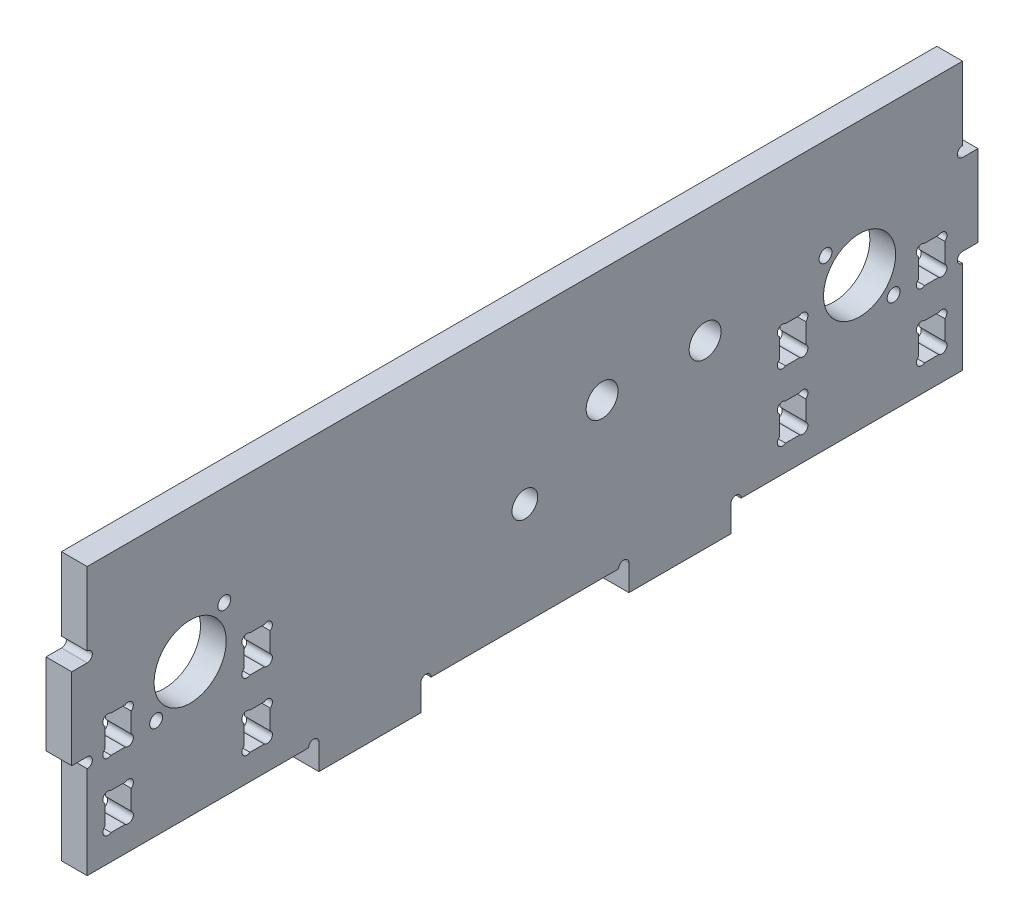
from build123d import *

# Parameters (mm, degrees)
SKETCH_1_W          = 170
SKETCH_1_H          = 52
EXTRUDE_1_DEPTH     = 5
SKETCH_2_R          = 7
CUT_EXTRUDE_1_DEPTH = 10
SKETCH_3_W          = 19.8
SKETCH_3_H          = 5
EXTRUDE_2_DEPTH     = 5
SKETCH_8_W          = 3
SKETCH_8_H          = 15.8
EXTRUDE_3_DEPTH     = 5
SKETCH_7_R          = 1
CUT_EXTRUDE_3_DEPTH = 10
SKETCH_10_W         = 5.1
SKETCH_10_H         = 7.1
CUT_EXTRUDE_4_DEPTH = 10
SKETCH_11_R         = 1
CUT_EXTRUDE_5_DEPTH = 10
SKETCH_13_R         = 3.1
SKETCH_13_R_2       = 2.5
CUT_EXTRUDE_7_DEPTH = 10
SKETCH_14_R         = 1.25
CUT_EXTRUDE_8_DEPTH = 10


with BuildPart() as part:
    # 스케치1 → 보스-돌출1 (new body)
    with BuildSketch(Plane(origin=(0, 0, 0), x_dir=(0, 0, -1), z_dir=(1, 0, 0))):
        with Locations((85, 26)):
            Rectangle(SKETCH_1_W, SKETCH_1_H)
    extrude(amount=EXTRUDE_1_DEPTH)

    # 스케치2 → 컷-돌출1 (cut)
    with BuildSketch(Plane(origin=(5, 0, 0), x_dir=(0, 0, -1), z_dir=(1, 0, 0))):
        with Locations((150, 26)):
            Circle(SKETCH_2_R)
        with Locations((20, 26)):
            Circle(SKETCH_2_R)
    extrude(amount=-CUT_EXTRUDE_1_DEPTH, mode=Mode.SUBTRACT)

    # 스케치3 → 보스-돌출2 (add)
    with BuildSketch(Plane(origin=(5, 0, 0), x_dir=(0, 0, -1), z_dir=(1, 0, 0))):
        with Locations((54.9, -2.5)):
            Rectangle(SKETCH_3_W, SKETCH_3_H)
        with Locations((115.1, -2.5)):
            Rectangle(SKETCH_3_W, SKETCH_3_H)
    extrude(amount=-EXTRUDE_2_DEPTH)

    # 스케치8 → 보스-돌출3 (add)
    with BuildSketch(Plane(origin=(5, 0, 0), x_dir=(0, 0, -1), z_dir=(1, 0, 0))):
        with Locations((171.5, 27.9)):
            Rectangle(SKETCH_8_W, SKETCH_8_H)
        with Locations((-1.5, 27.9)):
            Rectangle(SKETCH_8_W, SKETCH_8_H)
    extrude(amount=-EXTRUDE_3_DEPTH)

    # 스케치7 → 컷-돌출3 (cut)
    with BuildSketch(Plane(origin=(5, 0, 0), x_dir=(0, 0, -1), z_dir=(1, 0, 0))):
        with Locations((65.8, 0)):
            Circle(SKETCH_7_R)
        with Locations((44, 0)):
            Circle(SKETCH_7_R)
        with Locations((104.2, 0)):
            Circle(SKETCH_7_R)
        with Locations((126, 0)):
            Circle(SKETCH_7_R)
        with Locations((170, 36.8)):
            Circle(SKETCH_7_R)
        with Locations((170, 19)):
            Circle(SKETCH_7_R)
        with Locations((0, 36.8)):
            Circle(SKETCH_7_R)
        with Locations((0, 19)):
            Circle(SKETCH_7_R)
    extrude(amount=-CUT_EXTRUDE_3_DEPTH, mode=Mode.SUBTRACT)

    # 스케치10 → 컷-돌출4 (cut)
    with BuildSketch(Plane.ZY):
        with Locations((-163.999999999, 21.5)):
            Rectangle(SKETCH_10_W, SKETCH_10_H)
        with Locations((-136.999999999, 21.5)):
            Rectangle(SKETCH_10_W, SKETCH_10_H)
        with Locations((-163.999999999, 8.5)):
            Rectangle(SKETCH_10_W, SKETCH_10_H)
        with Locations((-136.999999999, 8.5)):
            Rectangle(SKETCH_10_W, SKETCH_10_H)
        with Locations((-33.000000001, 8.5)):
            Rectangle(SKETCH_10_W, SKETCH_10_H)
        with Locations((-6.000000001, 8.5)):
            Rectangle(SKETCH_10_W, SKETCH_10_H)
        with Locations((-33.000000001, 21.5)):
            Rectangle(SKETCH_10_W, SKETCH_10_H)
        with Locations((-6.000000001, 21.5)):
            Rectangle(SKETCH_10_W, SKETCH_10_H)
    extrude(amount=-CUT_EXTRUDE_4_DEPTH, mode=Mode.SUBTRACT)

    # 스케치11 → 컷-돌출5 (cut)
    with BuildSketch(Plane(origin=(5, 0, 0), x_dir=(0, 0, -1), z_dir=(1, 0, 0))):
        with Locations((165.966599684, 24.237815247)):
            Circle(SKETCH_11_R)
        with Locations((162.033400314, 24.237815247)):
            Circle(SKETCH_11_R)
        with Locations((165.966599684, 18.762184753)):
            Circle(SKETCH_11_R)
        with Locations((162.033400314, 18.762184753)):
            Circle(SKETCH_11_R)
        with Locations((138.966599684, 18.762184753)):
            Circle(SKETCH_11_R)
        with Locations((135.033400314, 18.762184753)):
            Circle(SKETCH_11_R)
        with Locations((138.966599684, 24.237815247)):
            Circle(SKETCH_11_R)
        with Locations((135.033400314, 24.237815247)):
            Circle(SKETCH_11_R)
        with Locations((135.033400314, 5.762184753)):
            Circle(SKETCH_11_R)
        with Locations((138.966599684, 5.762184753)):
            Circle(SKETCH_11_R)
        with Locations((135.033400314, 11.237815247)):
            Circle(SKETCH_11_R)
        with Locations((138.966599684, 11.237815247)):
            Circle(SKETCH_11_R)
        with Locations((162.033400314, 11.237815247)):
            Circle(SKETCH_11_R)
        with Locations((165.966599684, 11.237815247)):
            Circle(SKETCH_11_R)
        with Locations((162.033400314, 5.762184753)):
            Circle(SKETCH_11_R)
        with Locations((165.966599684, 5.762184753)):
            Circle(SKETCH_11_R)
        with Locations((4.033400316, 5.762184753)):
            Circle(SKETCH_11_R)
        with Locations((7.966599686, 5.762184753)):
            Circle(SKETCH_11_R)
        with Locations((4.033400316, 11.237815247)):
            Circle(SKETCH_11_R)
        with Locations((7.966599686, 11.237815247)):
            Circle(SKETCH_11_R)
        with Locations((31.033400316, 11.237815247)):
            Circle(SKETCH_11_R)
        with Locations((34.966599686, 11.237815247)):
            Circle(SKETCH_11_R)
        with Locations((31.033400316, 5.762184753)):
            Circle(SKETCH_11_R)
        with Locations((34.966599686, 5.762184753)):
            Circle(SKETCH_11_R)
        with Locations((34.966599686, 24.237815247)):
            Circle(SKETCH_11_R)
        with Locations((31.033400316, 24.237815247)):
            Circle(SKETCH_11_R)
        with Locations((34.966599686, 18.762184753)):
            Circle(SKETCH_11_R)
        with Locations((31.033400316, 18.762184753)):
            Circle(SKETCH_11_R)
        with Locations((7.966599686, 18.762184753)):
            Circle(SKETCH_11_R)
        with Locations((4.033400316, 18.762184753)):
            Circle(SKETCH_11_R)
        with Locations((7.966599686, 24.237815247)):
            Circle(SKETCH_11_R)
        with Locations((4.033400316, 24.237815247)):
            Circle(SKETCH_11_R)
    extrude(amount=-CUT_EXTRUDE_5_DEPTH, mode=Mode.SUBTRACT)

    # 스케치13 → 컷-돌출7 (cut)
    with BuildSketch(Plane(origin=(5, 0, 0), x_dir=(0, 0, -1), z_dir=(1, 0, 0))):
        with Locations((100, 30)):
            Circle(SKETCH_13_R)
        with Locations((120, 30)):
            Circle(SKETCH_13_R)
        with Locations((85, 20)):
            Circle(SKETCH_13_R_2)
    extrude(amount=-CUT_EXTRUDE_7_DEPTH, mode=Mode.SUBTRACT)

    # 스케치14 → 컷-돌출8 (cut)
    with BuildSketch(Plane(origin=(5, 0, 0), x_dir=(0, 0, -1), z_dir=(1, 0, 0))):
        with Locations((156.611448404, 19.388551596)):
            Circle(SKETCH_14_R)
        with Locations((143.388551596, 32.611448404)):
            Circle(SKETCH_14_R)
        with Locations((13.388551596, 19.388551596)):
            Circle(SKETCH_14_R)
        with Locations((26.611448404, 32.611448404)):
            Circle(SKETCH_14_R)
    extrude(amount=-CUT_EXTRUDE_8_DEPTH, mode=Mode.SUBTRACT)


solid = part.part
